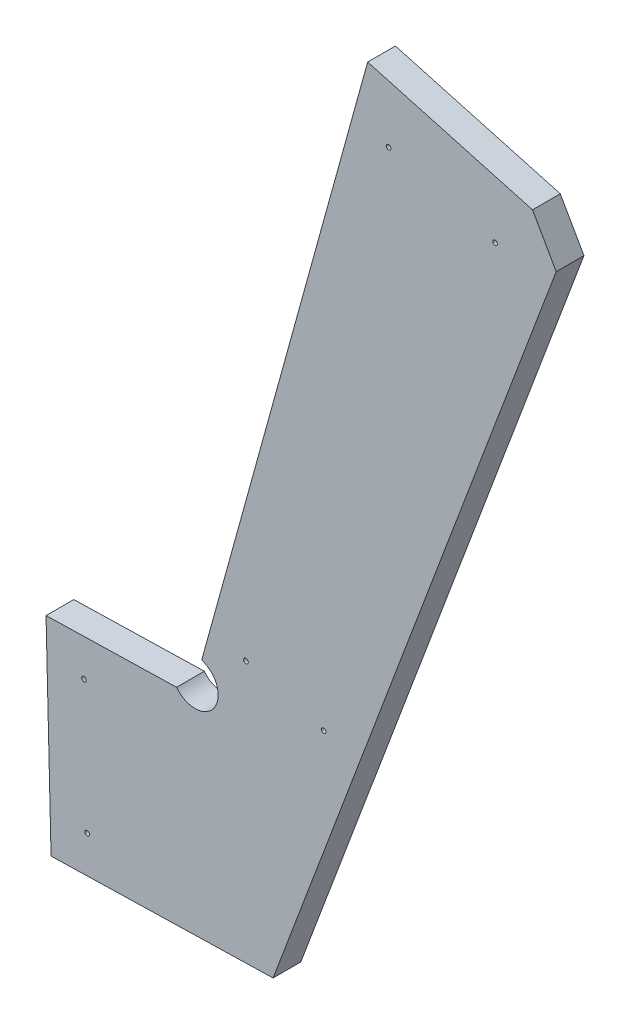
from build123d import *

# Parameters (mm, degrees)
BOSS_EXTRUDE1_DEPTH = 19.05
HOLE2_D             = 3.175
HOLE2_DEPTH         = 31.75
HOLE2_CSINK_D       = 10.16
HOLE2_CSINK_ANGLE   = 82
HOLE2_TIP           = 0.953866233
HOLE3_D             = 3.175
HOLE3_DEPTH         = 38.1
HOLE3_CSINK_D       = 10.16
HOLE3_CSINK_ANGLE   = 82
HOLE3_TIP           = 0.953866233


with BuildPart() as part:
    # Sketch1 → Boss-Extrude1 (new body)
    with BuildSketch(Plane.XY):
        with BuildLine():
            Line((-45.645654956, -462.283590669), (-42.196851456, -603.529354269))
            Line((-42.196851456, -603.529354269), (110.157739028, -599.809306096))
            Line((110.157739028, -599.809306096), (304.502022379, -82.799914861))
            Line((304.502022379, -82.799914861), (288.249001778, -54.142860136))
            Line((288.249001778, -54.142860136), (175.093421906, -22.889613201))
            Line((175.093421906, -22.889613201), (61.177817241, -435.332721236))
            ThreePointArc((61.177817241, -435.332721236), (69.660650717, -459.60790015), (43.950640658, -460.09591431))
            Line((43.950640658, -460.09591431), (-45.645654956, -462.283590669))
        make_face()
    extrude(amount=BOSS_EXTRUDE1_DEPTH)

    # Hole2
    with Locations(Plane(origin=(162.245907498, -21.702082459, 165.474999994), x_dir=(0, 0, -1), z_dir=(-0.9639097761610324, 0.2662291182819574, 0))):
        with Locations((-155.949999994, 107.734820482), (155.949999994, 107.734820482), (155.949999994, 327.755881328), (174.999999994, 85.732714397), (174.999999994, 349.757987412), (-174.999999994, 349.757987412), (-174.999999994, 85.732714397), (-155.949999994, 327.755881328)):
            CounterSinkHole(HOLE2_D / 2, HOLE2_CSINK_D / 2, depth=HOLE2_DEPTH, counter_sink_angle=HOLE2_CSINK_ANGLE)
            with Locations((0, 0, -(HOLE2_DEPTH + HOLE2_TIP / 2))):  # 118° drill point
                Cone(0, HOLE2_D / 2, HOLE2_TIP, mode=Mode.SUBTRACT)

    # Hole3
    with Locations(Plane(origin=(311.92831292, -63.043933951, -19.05), x_dir=(-0.3518626346959965, -0.9360516472421764, 8.51430303154421e-15), z_dir=(0, 0, -1))):
        with Locations((46.221112845, 113.488854888), (39.39759596, 37.945520226), (412.28786892, 80.423559293), (407.308516105, 25.297013484), (513.561319184, 161.164706775), (597.46020397, 127.267357003), (610.543339245, 159.649253123), (694.322923815, 367.011001477), (526.644454459, 193.546602895), (610.424039029, 400.908351249)):
            CounterSinkHole(HOLE3_D / 2, HOLE3_CSINK_D / 2, depth=HOLE3_DEPTH, counter_sink_angle=HOLE3_CSINK_ANGLE)
            with Locations((0, 0, -(HOLE3_DEPTH + HOLE3_TIP / 2))):  # 118° drill point
                Cone(0, HOLE3_D / 2, HOLE3_TIP, mode=Mode.SUBTRACT)


solid = part.part
